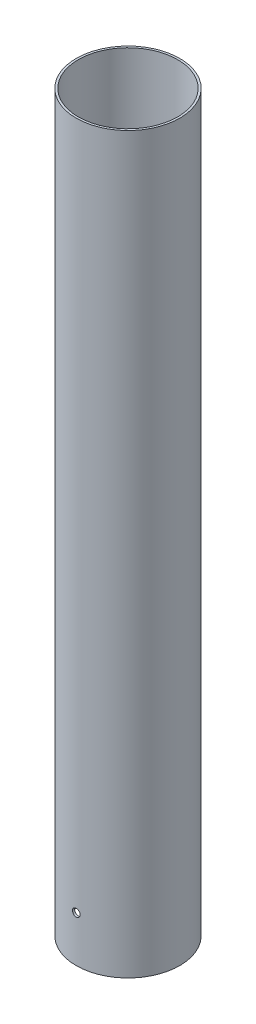
from build123d import *

# Parameters (mm, degrees)
SKETCH1_R               = 43
SKETCH1_R_2             = 41.25
BOSS_EXTRUDE1_DEPTH     = 609.6
CUT_EXTRUDE1_DEPTH      = 613.625627933
CUT_EXTRUDE1_DEPTH_BACK = 613.625627933
SKETCH2_R               = 3.175


with BuildPart() as part:
    # Sketch1 → Boss-Extrude1 (new body)
    with BuildSketch(Plane(origin=(0, 0, 0), x_dir=(1, 0, 0), z_dir=(0, 1, 0))):
        Circle(SKETCH1_R)
        Circle(SKETCH1_R_2, mode=Mode.SUBTRACT)
    extrude(amount=BOSS_EXTRUDE1_DEPTH)

    # Sketch2 → Cut-Extrude1 (cut, two sides: drawn at the far end of the back side and taken through both)
    with BuildSketch(Plane.XY.offset(-CUT_EXTRUDE1_DEPTH_BACK)):
        with Locations((0, 38.1)):
            Circle(SKETCH2_R)
    extrude(amount=CUT_EXTRUDE1_DEPTH + CUT_EXTRUDE1_DEPTH_BACK, mode=Mode.SUBTRACT)


solid = part.part
